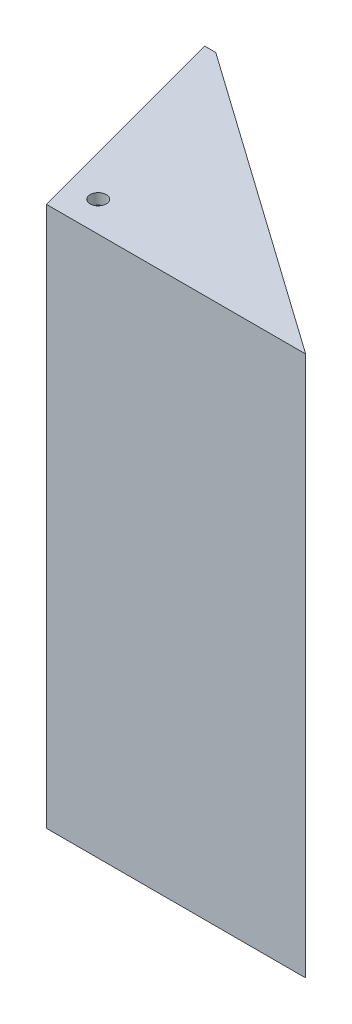
from build123d import *

# Parameters (mm, degrees)
BOSS_EXTRUDE1_DEPTH = 3.175
BOSS_EXTRUDE3_DEPTH = 152.4
BOSS_EXTRUDE4_DEPTH = 3.175
CHAMFER1_SIZE2      = 3.175
CHAMFER1_SIZE       = 11.849261314
SKETCH4_R           = 2.38125
CUT_EXTRUDE1_DEPTH  = 158.75
CUT_EXTRUDE2_DEPTH  = 254
SKETCH7_R           = 1.5875
CUT_EXTRUDE3_DEPTH  = 7.62


with BuildPart() as part:
    # Sketch1 → Boss-Extrude1 (new body)
    with BuildSketch(Plane(origin=(0, 0, 0), x_dir=(1, 0, 0), z_dir=(0, 1, 0))):
        Polygon((0, 0), (76.2, 0), (76.2, 63.5), (-17.014773719, 63.5), align=None)
    extrude(amount=BOSS_EXTRUDE1_DEPTH)

    # Sketch2 → Boss-Extrude3 (add)
    with BuildSketch(Plane(origin=(0, 3.175, 0), x_dir=(1, 0, 0), z_dir=(0, 1, 0))):
        Polygon((76.2, 0), (0, 0), (-17.014773719, 63.5), (-13.727771847, 63.5), (2.436263187, 3.175), (76.2, 3.175), align=None)
    extrude(amount=BOSS_EXTRUDE3_DEPTH)

    # Sketch3 → Boss-Extrude4 (add)
    with BuildSketch(Plane(origin=(0, 155.575, 0), x_dir=(1, 0, 0), z_dir=(0, 1, 0))):
        Polygon((-17.014773719, 63.5), (0, 0), (76.2, 0), (76.2, 63.5), align=None)
    extrude(amount=BOSS_EXTRUDE4_DEPTH)

    # Chamfer1
    chamfer1_edges = [part.edges().sort_by_distance(p)[0] for p in [
        (76.2, 79.375, -3.175),
    ]]
    chamfer1_side = [part.faces().sort_by_distance(p)[0] for p in [
        (76.1365, 79.375, -3.175),
    ]]
    chamfer(chamfer1_edges, length=CHAMFER1_SIZE - 0.0001, length2=CHAMFER1_SIZE2 - 0.0001, reference=chamfer1_side[0])  # a hair under: the kernel refuses the full size

    # Sketch4 → Cut-Extrude1 (cut)
    with BuildSketch(Plane.XZ):
        with Locations(Location((6.35, -8.89, 0), (0, 0, 270))):
            Circle(SKETCH4_R)
    extrude(amount=-CUT_EXTRUDE1_DEPTH, mode=Mode.SUBTRACT)

    # Sketch6 → Cut-Extrude2 (cut)
    with BuildSketch(Plane(origin=(0, 158.75, 0), x_dir=(1, 0, 0), z_dir=(0, 1, 0))):
        Polygon((-13.727771847, 63.5), (76.2, 0), (76.2, 63.5), align=None)
    extrude(amount=-CUT_EXTRUDE2_DEPTH, mode=Mode.SUBTRACT)

    # Sketch7 → Cut-Extrude3 (cut)
    with BuildSketch(Plane(origin=(3.066814498, 0, -0.821750468), x_dir=(-0.25881904510251846, 0, -0.965925826289069), z_dir=(0.965925826289069, 0, -0.25881904510251846))):
        with Locations((61.07929877, 38.1)):
            Circle(SKETCH7_R)
    extrude(amount=-CUT_EXTRUDE3_DEPTH, mode=Mode.SUBTRACT)


solid = part.part
